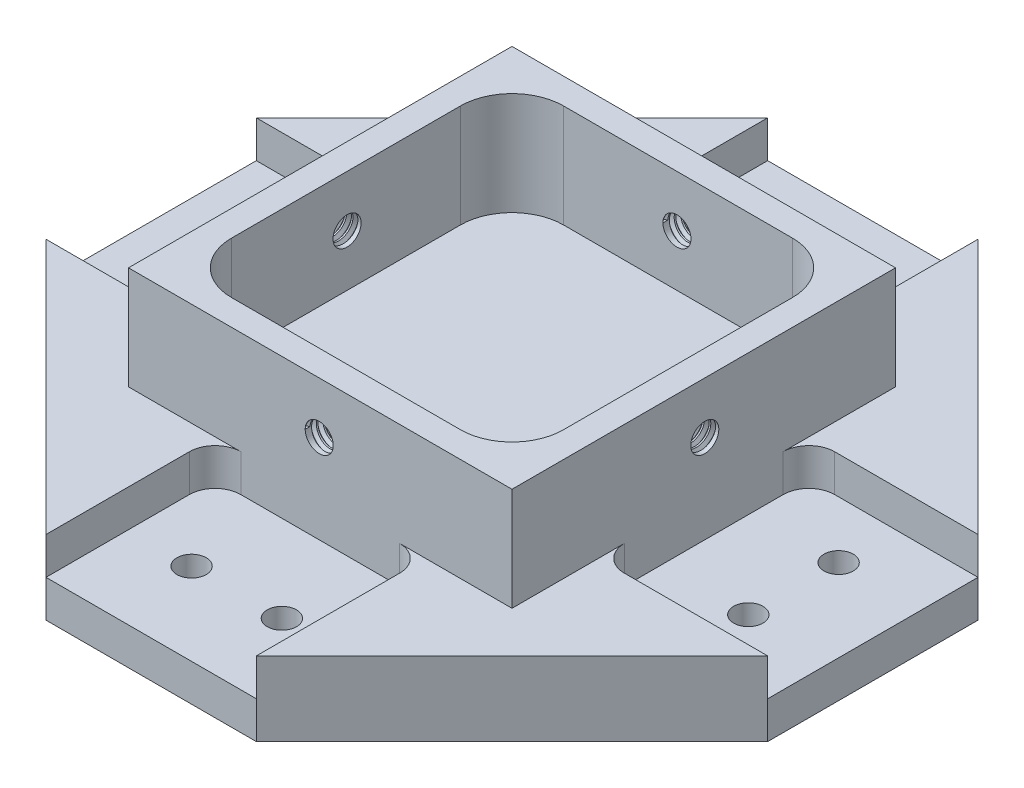
from build123d import *
from build123d.topology import SkipClean

# Parameters (mm, degrees)
SKETCH1_W           = 88.9
SKETCH1_H           = 88.9
BOSS_EXTRUDE1_DEPTH = 9.144
SKETCH2_W           = 25.908
SKETCH2_H           = 21.59
SKETCH2_W_2         = 21.59
SKETCH2_H_2         = 25.908
CUT_EXTRUDE1_DEPTH  = 4.572
SKETCH4_R           = 1.8034
CUT_EXTRUDE3_DEPTH  = 126.806689743
CUT_EXTRUDE5_DEPTH  = 127.055673161
BOSS_EXTRUDE2_START = -4.572
SKETCH7_W           = 47.244
SKETCH7_H           = 47.244
SKETCH7_W_2         = 40.894
SKETCH7_H_2         = 40.894
BOSS_EXTRUDE2_DEPTH = 17.272
FILLET9_R           = 6.35
FILLET10_R          = 6.35
FILLET11_R          = 6.35
FILLET12_R          = 6.35
FILLET15_R          = 3.175
FILLET16_R          = 3.175
FILLET17_R          = 3.175
FILLET18_R          = 3.175
FILLET19_R          = 3.175
FILLET20_R          = 3.175
FILLET21_R          = 3.175
FILLET22_R          = 3.175
SKETCH9_R           = 1.7272
CUT_EXTRUDE6_DEPTH  = 115.079654277
SKETCH10_R          = 1.7272
CUT_EXTRUDE7_DEPTH  = 115.079654277
SKETCH14_R          = 2.54
CUT_EXTRUDE9_DEPTH  = 128.607132779
CUT_EXTRUDE10_DEPTH = 127.363404513
THREAD1_PITCH       = 0.79375
THREAD2_PITCH       = 0.79375
THREAD3_PITCH       = 0.79375
THREAD4_PITCH       = 0.79375


with BuildPart() as part:
    # Sketch1 → Boss-Extrude1 (new body)
    with BuildSketch(Plane(origin=(0, 0, 0), x_dir=(1, 0, 0), z_dir=(0, 1, 0))):
        with Locations((44.45, 44.45)):
            Rectangle(SKETCH1_W, SKETCH1_H)
    extrude(amount=BOSS_EXTRUDE1_DEPTH)

    # Sketch2 → Cut-Extrude1 (cut)
    with BuildSketch(Plane(origin=(0, 9.144, 0), x_dir=(1, 0, 0), z_dir=(0, 1, 0))):
        with Locations((44.45, 78.105)):
            Rectangle(SKETCH2_W, SKETCH2_H)
        with Locations((10.795, 44.45)):
            Rectangle(SKETCH2_W_2, SKETCH2_H_2)
        with Locations((44.45, 10.795)):
            Rectangle(SKETCH2_W, SKETCH2_H)
        with Locations((78.105, 44.45)):
            Rectangle(SKETCH2_W_2, SKETCH2_H_2)
    extrude(amount=-CUT_EXTRUDE1_DEPTH, mode=Mode.SUBTRACT)

    # Sketch4 → Cut-Extrude3 (cut, through all)
    with BuildSketch(Plane(origin=(0, 4.572, 0), x_dir=(1, 0, 0), z_dir=(0, 1, 0))):
        with Locations(Location((78.74, 50.3936, 0), (0, 0, 270))):
            Circle(SKETCH4_R)
        with Locations(Location((78.74, 39.2684, 0), (0, 0, 270))):
            Circle(SKETCH4_R)
        with Locations(Location((49.6316, 78.74, 0), (0, 0, 270))):
            Circle(SKETCH4_R)
        with Locations(Location((38.5064, 78.74, 0), (0, 0, 270))):
            Circle(SKETCH4_R)
        with Locations(Location((10.16, 50.3936, 0), (0, 0, 270))):
            Circle(SKETCH4_R)
        with Locations(Location((10.16, 39.2684, 0), (0, 0, 270))):
            Circle(SKETCH4_R)
        with Locations(Location((39.2684, 10.16, 0), (0, 0, 270))):
            Circle(SKETCH4_R)
        with Locations(Location((50.3936, 10.16, 0), (0, 0, 270))):
            Circle(SKETCH4_R)
    extrude(amount=-CUT_EXTRUDE3_DEPTH, mode=Mode.SUBTRACT)

    # Sketch6 → Cut-Extrude5 (cut, through all)
    with BuildSketch(Plane(origin=(0, 9.144, 0), x_dir=(1, 0, 0), z_dir=(0, 1, 0))):
        Polygon((88.9, 31.496), (57.404, 0), (88.9, 0), align=None)
    extrude(amount=-CUT_EXTRUDE5_DEPTH, mode=Mode.SUBTRACT)

    # Sketch7 → Boss-Extrude2 (add)
    with BuildSketch(Plane(origin=(0, 9.144, 0), x_dir=(1, 0, 0), z_dir=(0, 1, 0)).offset(BOSS_EXTRUDE2_START)):
        with Locations((44.45, 44.45)):
            Rectangle(SKETCH7_W, SKETCH7_H)
        with Locations((44.45, 44.45)):
            Rectangle(SKETCH7_W_2, SKETCH7_H_2, mode=Mode.SUBTRACT)
    extrude(amount=BOSS_EXTRUDE2_DEPTH)

    # Fillet9
    fillet9_edges = [part.edges().sort_by_distance(p)[0] for p in [
        (64.897, 15.494, -24.003),
    ]]
    fillet(fillet9_edges, radius=FILLET9_R)

    # Fillet10
    fillet10_edges = [part.edges().sort_by_distance(p)[0] for p in [
        (24.003, 15.494, -24.003),
    ]]
    fillet(fillet10_edges, radius=FILLET10_R)

    # Fillet11
    fillet11_edges = [part.edges().sort_by_distance(p)[0] for p in [
        (64.897, 15.494, -64.897),
    ]]
    fillet(fillet11_edges, radius=FILLET11_R)

    # Fillet12
    fillet12_edges = [part.edges().sort_by_distance(p)[0] for p in [
        (24.003, 15.494, -64.897),
    ]]
    fillet(fillet12_edges, radius=FILLET12_R)

    # Fillet15
    fillet15_edges = [part.edges().sort_by_distance(p)[0] for p in [
        (20.828, 6.858, -57.404),
    ]]
    fillet(fillet15_edges, radius=FILLET15_R)

    # Fillet16
    fillet16_edges = [part.edges().sort_by_distance(p)[0] for p in [
        (31.496, 6.858, -20.828),
    ]]
    fillet(fillet16_edges, radius=FILLET16_R)

    # Fillet17
    fillet17_edges = [part.edges().sort_by_distance(p)[0] for p in [
        (57.404, 6.858, -20.828),
    ]]
    fillet(fillet17_edges, radius=FILLET17_R)

    # Fillet18
    fillet18_edges = [part.edges().sort_by_distance(p)[0] for p in [
        (68.072, 6.858, -57.404),
    ]]
    fillet(fillet18_edges, radius=FILLET18_R)

    # Fillet19
    fillet19_edges = [part.edges().sort_by_distance(p)[0] for p in [
        (68.072, 6.858, -31.496),
    ]]
    fillet(fillet19_edges, radius=FILLET19_R)

    # Fillet20
    fillet20_edges = [part.edges().sort_by_distance(p)[0] for p in [
        (31.496, 6.858, -68.072),
    ]]
    fillet(fillet20_edges, radius=FILLET20_R)

    # Fillet21
    fillet21_edges = [part.edges().sort_by_distance(p)[0] for p in [
        (57.404, 6.858, -68.072),
    ]]
    fillet(fillet21_edges, radius=FILLET21_R)

    # Fillet22
    fillet22_edges = [part.edges().sort_by_distance(p)[0] for p in [
        (20.828, 6.858, -31.496),
    ]]
    fillet(fillet22_edges, radius=FILLET22_R)

    # Sketch9 → Cut-Extrude6 (cut, through all)
    with BuildSketch(Plane(origin=(0, 0, -68.072), x_dir=(-1, 0, 0), z_dir=(0, 0, -1))):
        with Locations((-44.323, 15.494)):
            Circle(SKETCH9_R)
    extrude(amount=-CUT_EXTRUDE6_DEPTH, mode=Mode.SUBTRACT)

    # Sketch10 → Cut-Extrude7 (cut, through all)
    with BuildSketch(Plane(origin=(68.072, 0, 0), x_dir=(0, 0, -1), z_dir=(1, 0, 0))):
        with Locations((44.577, 15.494)):
            Circle(SKETCH10_R)
    extrude(amount=-CUT_EXTRUDE7_DEPTH, mode=Mode.SUBTRACT)

    # Sketch14 → Cut-Extrude9 (cut, through all)
    with BuildSketch(Plane.XZ):
        with Locations(Location((28.861551788, -28.861551788, 0), (0, 0, 270))):
            Circle(SKETCH14_R)
        with Locations(Location((60.292448212, -60.292448212, 0), (0, 0, 270))):
            Circle(SKETCH14_R)
    extrude(amount=-CUT_EXTRUDE9_DEPTH, mode=Mode.SUBTRACT)

    # Sketch12 → Cut-Extrude10 (cut, through all)
    with BuildSketch(Plane(origin=(0, 9.144, 0), x_dir=(1, 0, 0), z_dir=(0, 1, 0))):
        Polygon((0, 31.496), (31.496, 0), (0, 0), align=None)
        Polygon((57.404, 88.9), (88.9, 57.404), (88.9, 88.9), align=None)
        Polygon((0, 57.404), (31.496, 88.9), (0, 88.9), align=None)
    extrude(amount=-CUT_EXTRUDE10_DEPTH, mode=Mode.SUBTRACT)

    # Thread1: the profile of Thread Profile1 profile screwed along a right-hand helix of 4 turns, 8 arcs to a turn; built about Z, then put on its axis
    thread1_z = Axis((0, 0, 0), (0, 0, 1))
    thread1_corners = [(1.7269, 0, -0.000173205), (2.156829788, 0, 0.248046874), (2.156829788, 0, 0.347265624), (1.7269, 0, 0.595485703)]
    with BuildLine(mode=Mode.PRIVATE) as thread1_profile:
        Line(thread1_corners[0], thread1_corners[1])
        Line(thread1_corners[1], thread1_corners[2])
        Line(thread1_corners[2], thread1_corners[3])
        Line(thread1_corners[3], thread1_corners[0])
    thread1_cap = Face(thread1_profile.wire())
    thread1_turn_angles = [0, 22.5, 45, 67.5, 90, 112.5, 135, 157.5, 180, 202.5, 225, 247.5, 270, 292.5, 315, 337.5, 360]
    thread1_turn_weights = [1, 0.9238795325112867, 1, 0.9238795325112867, 1, 0.9238795325112867, 1, 0.9238795325112867, 1, 0.9238795325112867, 1, 0.9238795325112867, 1, 0.9238795325112867, 1, 0.9238795325112867, 1]
    thread1_turn_rails = [Edge.make_bspline([Vector(p[0], p[1], 0).rotate(thread1_z, thread1_turn_angles[k]) / thread1_turn_weights[k] + Vector(0, 0, p[2] + THREAD1_PITCH * thread1_turn_angles[k] / 360) for k in range(17)], [0, 0, 0, 1, 1, 2, 2, 3, 3, 4, 4, 5, 5, 6, 6, 7, 7, 8, 8, 8], 2, thread1_turn_weights) for p in thread1_corners]
    thread1_turn_sides = [Face.make_surface_from_curves(thread1_turn_rails[p[0]], thread1_turn_rails[p[1]]) for p in [(0, 1), (1, 2), (2, 3), (3, 0)]]
    thread1 = Plane(origin=(44.323, 15.494, -20.828), x_dir=(-1, 0, 0), z_dir=(0, 0, -1)) * Solid(Shell([*[p.moved(Location((0, 0, THREAD1_PITCH * i))) for i in range(4) for p in thread1_turn_sides], thread1_cap, thread1_cap.rotate(thread1_z, 1440).moved(Location((0, 0, THREAD1_PITCH * 1440 / 360)))]))
    add(thread1, mode=Mode.SUBTRACT)

    # Thread2: the profile of Thread Profile2 profile screwed along a right-hand helix of 4 turns, 8 arcs to a turn; built about Z, then put on its axis
    with SkipClean():  # the faces are left unmerged after this step: merging them gives an invalid solid
        thread2_z = Axis((0, 0, 0), (0, 0, 1))
        thread2_corners = [(1.7269, 0, -0.000173205), (2.156829788, 0, 0.248046874), (2.156829788, 0, 0.347265624), (1.7269, 0, 0.595485703)]
        with BuildLine(mode=Mode.PRIVATE) as thread2_profile:
            Line(thread2_corners[0], thread2_corners[1])
            Line(thread2_corners[1], thread2_corners[2])
            Line(thread2_corners[2], thread2_corners[3])
            Line(thread2_corners[3], thread2_corners[0])
        thread2_cap = Face(thread2_profile.wire())
        thread2_turn_angles = [0, 22.5, 45, 67.5, 90, 112.5, 135, 157.5, 180, 202.5, 225, 247.5, 270, 292.5, 315, 337.5, 360]
        thread2_turn_weights = [1, 0.9238795325112867, 1, 0.9238795325112867, 1, 0.9238795325112867, 1, 0.9238795325112867, 1, 0.9238795325112867, 1, 0.9238795325112867, 1, 0.9238795325112867, 1, 0.9238795325112867, 1]
        thread2_turn_rails = [Edge.make_bspline([Vector(p[0], p[1], 0).rotate(thread2_z, thread2_turn_angles[k]) / thread2_turn_weights[k] + Vector(0, 0, p[2] + THREAD2_PITCH * thread2_turn_angles[k] / 360) for k in range(17)], [0, 0, 0, 1, 1, 2, 2, 3, 3, 4, 4, 5, 5, 6, 6, 7, 7, 8, 8, 8], 2, thread2_turn_weights) for p in thread2_corners]
        thread2_turn_sides = [Face.make_surface_from_curves(thread2_turn_rails[p[0]], thread2_turn_rails[p[1]]) for p in [(0, 1), (1, 2), (2, 3), (3, 0)]]
        thread2 = Plane(origin=(68.072, 15.494, -44.577), x_dir=(0, 0, 1), z_dir=(-1, 0, 0)) * Solid(Shell([*[p.moved(Location((0, 0, THREAD2_PITCH * i))) for i in range(4) for p in thread2_turn_sides], thread2_cap, thread2_cap.rotate(thread2_z, 1440).moved(Location((0, 0, THREAD2_PITCH * 1440 / 360)))]))
        add(thread2, mode=Mode.SUBTRACT)

    # Thread3: the profile of Thread Profile3 profile screwed along a right-hand helix of 4 turns, 8 arcs to a turn; built about Z, then put on its axis
    thread3_z = Axis((0, 0, 0), (0, 0, 1))
    thread3_corners = [(1.7269, 0, -0.000173205), (2.156829788, 0, 0.248046874), (2.156829788, 0, 0.347265624), (1.7269, 0, 0.595485703)]
    with BuildLine(mode=Mode.PRIVATE) as thread3_profile:
        Line(thread3_corners[0], thread3_corners[1])
        Line(thread3_corners[1], thread3_corners[2])
        Line(thread3_corners[2], thread3_corners[3])
        Line(thread3_corners[3], thread3_corners[0])
    thread3_cap = Face(thread3_profile.wire())
    thread3_turn_angles = [0, 22.5, 45, 67.5, 90, 112.5, 135, 157.5, 180, 202.5, 225, 247.5, 270, 292.5, 315, 337.5, 360]
    thread3_turn_weights = [1, 0.9238795325112867, 1, 0.9238795325112867, 1, 0.9238795325112867, 1, 0.9238795325112867, 1, 0.9238795325112867, 1, 0.9238795325112867, 1, 0.9238795325112867, 1, 0.9238795325112867, 1]
    thread3_turn_rails = [Edge.make_bspline([Vector(p[0], p[1], 0).rotate(thread3_z, thread3_turn_angles[k]) / thread3_turn_weights[k] + Vector(0, 0, p[2] + THREAD3_PITCH * thread3_turn_angles[k] / 360) for k in range(17)], [0, 0, 0, 1, 1, 2, 2, 3, 3, 4, 4, 5, 5, 6, 6, 7, 7, 8, 8, 8], 2, thread3_turn_weights) for p in thread3_corners]
    thread3_turn_sides = [Face.make_surface_from_curves(thread3_turn_rails[p[0]], thread3_turn_rails[p[1]]) for p in [(0, 1), (1, 2), (2, 3), (3, 0)]]
    thread3 = Plane(origin=(44.323, 15.494, -64.897), x_dir=(-1, 0, 0), z_dir=(0, 0, -1)) * Solid(Shell([*[p.moved(Location((0, 0, THREAD3_PITCH * i))) for i in range(4) for p in thread3_turn_sides], thread3_cap, thread3_cap.rotate(thread3_z, 1440).moved(Location((0, 0, THREAD3_PITCH * 1440 / 360)))]))
    add(thread3, mode=Mode.SUBTRACT)

    # Thread4: the profile of Thread Profile4 profile screwed along a right-hand helix of 4 turns, 8 arcs to a turn; built about Z, then put on its axis
    thread4_z = Axis((0, 0, 0), (0, 0, 1))
    thread4_corners = [(1.7269, 0, -0.000173205), (2.156829788, 0, 0.248046874), (2.156829788, 0, 0.347265624), (1.7269, 0, 0.595485703)]
    with BuildLine(mode=Mode.PRIVATE) as thread4_profile:
        Line(thread4_corners[0], thread4_corners[1])
        Line(thread4_corners[1], thread4_corners[2])
        Line(thread4_corners[2], thread4_corners[3])
        Line(thread4_corners[3], thread4_corners[0])
    thread4_cap = Face(thread4_profile.wire())
    thread4_turn_angles = [0, 22.5, 45, 67.5, 90, 112.5, 135, 157.5, 180, 202.5, 225, 247.5, 270, 292.5, 315, 337.5, 360]
    thread4_turn_weights = [1, 0.9238795325112867, 1, 0.9238795325112867, 1, 0.9238795325112867, 1, 0.9238795325112867, 1, 0.9238795325112867, 1, 0.9238795325112867, 1, 0.9238795325112867, 1, 0.9238795325112867, 1]
    thread4_turn_rails = [Edge.make_bspline([Vector(p[0], p[1], 0).rotate(thread4_z, thread4_turn_angles[k]) / thread4_turn_weights[k] + Vector(0, 0, p[2] + THREAD4_PITCH * thread4_turn_angles[k] / 360) for k in range(17)], [0, 0, 0, 1, 1, 2, 2, 3, 3, 4, 4, 5, 5, 6, 6, 7, 7, 8, 8, 8], 2, thread4_turn_weights) for p in thread4_corners]
    thread4_turn_sides = [Face.make_surface_from_curves(thread4_turn_rails[p[0]], thread4_turn_rails[p[1]]) for p in [(0, 1), (1, 2), (2, 3), (3, 0)]]
    thread4 = Plane(origin=(24.003, 15.494, -44.577), x_dir=(0, 0, 1), z_dir=(-1, 0, 0)) * Solid(Shell([*[p.moved(Location((0, 0, THREAD4_PITCH * i))) for i in range(4) for p in thread4_turn_sides], thread4_cap, thread4_cap.rotate(thread4_z, 1440).moved(Location((0, 0, THREAD4_PITCH * 1440 / 360)))]))
    add(thread4, mode=Mode.SUBTRACT)


solid = part.part
